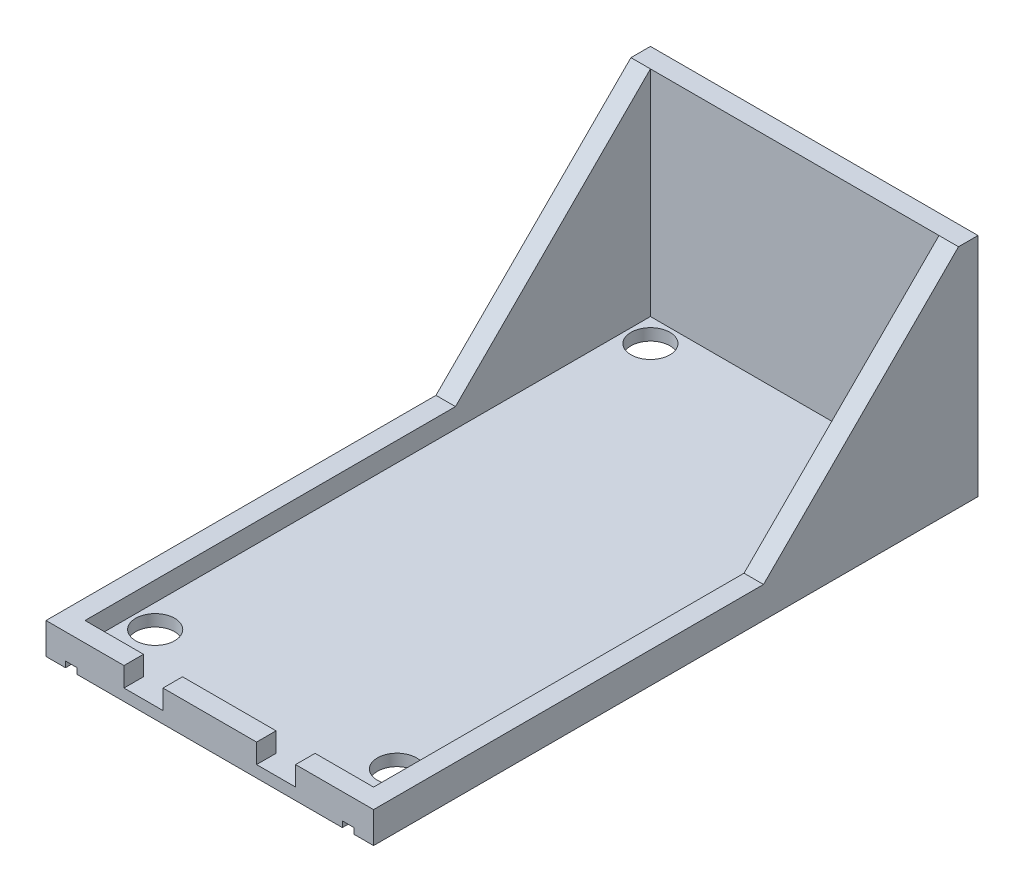
from build123d import *

# Parameters (mm, degrees)
SKETCH1_W           = 84
SKETCH1_H           = 155
BOSS_EXTRUDE1_DEPTH = 3
SKETCH2_W           = 3
SKETCH2_H           = 3
CUT_EXTRUDE1_DEPTH  = 3
SKETCH3_W           = 5
SKETCH3_H           = 8
BOSS_EXTRUDE2_DEPTH = 155
SKETCH4_W           = 5
SKETCH4_H           = 8
BOSS_EXTRUDE3_DEPTH = 155
SKETCH5_W           = 5
SKETCH5_H           = 58
BOSS_EXTRUDE4_DEPTH = 84
BOSS_EXTRUDE5_DEPTH = 5
BOSS_EXTRUDE6_DEPTH = 5
SKETCH8_W           = 84
SKETCH8_H           = 8
BOSS_EXTRUDE8_DEPTH = 5
SKETCH10_W          = 10
SKETCH10_H          = 7.49718506
CUT_EXTRUDE2_DEPTH  = 5
SKETCH11_W          = 10
SKETCH11_H          = 10.666578164
CUT_EXTRUDE3_DEPTH  = 5
SKETCH12_W          = 2.991300293
SKETCH12_H          = 5
CUT_EXTRUDE4_DEPTH  = 1.5
CUT_EXTRUDE5_DEPTH  = 1.5
SKETCH14_R          = 5
CUT_EXTRUDE6_DEPTH  = 10
SKETCH15_R          = 5
CUT_EXTRUDE7_DEPTH  = 10
SKETCH16_R          = 5
CUT_EXTRUDE8_DEPTH  = 10


with BuildPart() as part:
    # Sketch1 → Boss-Extrude1 (new body)
    with BuildSketch(Plane(origin=(0, 0, 0), x_dir=(1, 0, 0), z_dir=(0, 1, 0))):
        Rectangle(SKETCH1_W, SKETCH1_H)
    extrude(amount=BOSS_EXTRUDE1_DEPTH)

    # Sketch2 → Cut-Extrude1 (cut)
    with BuildSketch(Plane(origin=(0, 3, 0), x_dir=(1, 0, 0), z_dir=(0, 1, 0))):
        with Locations((35.5, -71)):
            Rectangle(SKETCH2_W, SKETCH2_H)
        with Locations((-35.5, -71)):
            Rectangle(SKETCH2_W, SKETCH2_H)
    extrude(amount=-CUT_EXTRUDE1_DEPTH, mode=Mode.SUBTRACT)

    # Sketch3 → Boss-Extrude2 (add)
    with BuildSketch(Plane.XY.offset(77.5)):
        with Locations((39.5, 4)):
            Rectangle(SKETCH3_W, SKETCH3_H)
    extrude(amount=-BOSS_EXTRUDE2_DEPTH)

    # Sketch4 → Boss-Extrude3 (add)
    with BuildSketch(Plane.XY.offset(77.5)):
        with Locations((-39.5, 4)):
            Rectangle(SKETCH4_W, SKETCH4_H)
    extrude(amount=-BOSS_EXTRUDE3_DEPTH)

    # Sketch5 → Boss-Extrude4 (add)
    with BuildSketch(Plane.ZY.offset(42)):
        with Locations((-75, 29)):
            Rectangle(SKETCH5_W, SKETCH5_H)
    extrude(amount=-BOSS_EXTRUDE4_DEPTH)

    # Sketch6 → Boss-Extrude5 (add)
    with BuildSketch(Plane.ZY.offset(42)):
        Polygon((-72.5, 58), (-22.5, 8), (-74.300026141, 4.41684906), (-74.300026141, 56.199973859), align=None)
    extrude(amount=-BOSS_EXTRUDE5_DEPTH)

    # Sketch7 → Boss-Extrude6 (add)
    with BuildSketch(Plane(origin=(42, 0, 0), x_dir=(0, 0, -1), z_dir=(1, 0, 0))):
        Polygon((72.5, 58), (19.108860597, 4.608860597), (75.247556584, 4.608860597), (75.247556584, 53.916409465), align=None)
    extrude(amount=-BOSS_EXTRUDE6_DEPTH)

    # Sketch8 → Boss-Extrude8 (add)
    with BuildSketch(Plane.XY.offset(77.5)):
        with Locations((0, 4)):
            Rectangle(SKETCH8_W, SKETCH8_H)
    extrude(amount=-BOSS_EXTRUDE8_DEPTH)

    # Sketch10 → Cut-Extrude2 (cut)
    with BuildSketch(Plane.XY.offset(77.5)):
        with Locations((-17, 6.74859253)):
            Rectangle(SKETCH10_W, SKETCH10_H)
    extrude(amount=-CUT_EXTRUDE2_DEPTH, mode=Mode.SUBTRACT)

    # Sketch11 → Cut-Extrude3 (cut)
    with BuildSketch(Plane.XY.offset(77.5)):
        with Locations((17, 8.333289082)):
            Rectangle(SKETCH11_W, SKETCH11_H)
    extrude(amount=-CUT_EXTRUDE3_DEPTH, mode=Mode.SUBTRACT)

    # Sketch12 → Cut-Extrude4 (cut)
    with BuildSketch(Plane(origin=(0, 0, 0), x_dir=(-1, 0, 0), z_dir=(0, -1, 0))):
        with Locations((35.504349854, -75)):
            Rectangle(SKETCH12_W, SKETCH12_H)
    extrude(amount=-CUT_EXTRUDE4_DEPTH, mode=Mode.SUBTRACT)

    # Sketch13 → Cut-Extrude5 (cut)
    with BuildSketch(Plane(origin=(0, 0, 0), x_dir=(-1, 0, 0), z_dir=(0, -1, 0))):
        Polygon((-34, -72.5), (-34, -80.193887821), (-37, -80.075389367), (-37, -72.5), align=None)
    extrude(amount=-CUT_EXTRUDE5_DEPTH, mode=Mode.SUBTRACT)

    # Sketch14 → Cut-Extrude6 (cut)
    with BuildSketch(Plane(origin=(0, 3, 0), x_dir=(1, 0, 0), z_dir=(0, 1, 0))):
        with Locations((-31, 66.5)):
            Circle(SKETCH14_R)
    extrude(amount=-CUT_EXTRUDE6_DEPTH, mode=Mode.SUBTRACT)

    # Sketch15 → Cut-Extrude7 (cut)
    with BuildSketch(Plane(origin=(0, 3, 0), x_dir=(1, 0, 0), z_dir=(0, 1, 0))):
        with Locations((31, 66.5)):
            Circle(SKETCH15_R)
    extrude(amount=-CUT_EXTRUDE7_DEPTH, mode=Mode.SUBTRACT)

    # Sketch16 → Cut-Extrude8 (cut)
    with BuildSketch(Plane(origin=(0, 3, 0), x_dir=(1, 0, 0), z_dir=(0, 1, 0))):
        with Locations((-31, -60.5)):
            Circle(SKETCH16_R)
        with Locations((31, -60.5)):
            Circle(SKETCH16_R)
    extrude(amount=-CUT_EXTRUDE8_DEPTH, mode=Mode.SUBTRACT)


solid = part.part
